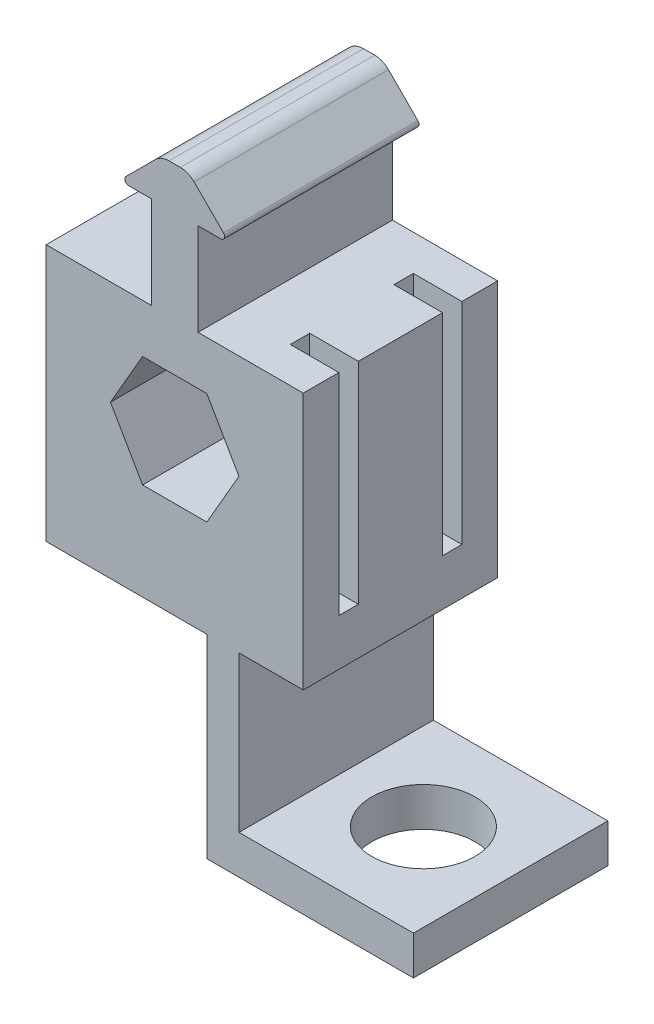
from build123d import *

# Parameters (mm, degrees)
BOSS_EXTRUDE1_DEPTH = 12.7
SKETCH8_W           = 2.54
SKETCH8_H           = 27.5
CUT_EXTRUDE1_DEPTH  = 6.35
SKETCH3_W           = 4.197769469
SKETCH3_H           = 25.4
BOSS_EXTRUDE2_DEPTH = 25.4
SKETCH4_W           = 22.800422122
SKETCH4_H           = 25.4
SKETCH4_R           = 6.75
BOSS_EXTRUDE3_DEPTH = 5.08


with BuildPart() as part:
    # Sketch1 → Boss-Extrude1 (new, symmetric)
    with BuildSketch(Plane.XY):
        with BuildLine():
            Line((-16.79575, 13.62075), (-16.79575, -19.97075))
            Line((-16.79575, -19.97075), (16.79575, -19.97075))
            Line((16.79575, -19.97075), (16.79575, 13.62075))
            Line((16.79575, 13.62075), (3.048, 13.62075))
            Line((3.048, 13.62075), (3.048, 25.68575))
            Line((3.048, 25.68575), (6.01257951, 25.68575))
            ThreePointArc((6.01257951, 25.68575), (6.481910313, 25.999346816), (6.371789755, 26.552960245))
            Line((6.371789755, 26.552960245), (2.532108776, 30.392641224))
            ThreePointArc((2.532108776, 30.392641224), (1.70807347, 30.943244013), (0.736057552, 31.13659))
            Line((0.736057552, 31.13659), (-0.736057552, 31.13659))
            ThreePointArc((-0.736057552, 31.13659), (-1.70807347, 30.943244013), (-2.532108776, 30.392641224))
            Line((-2.532108776, 30.392641224), (-6.371789755, 26.552960245))
            ThreePointArc((-6.371789755, 26.552960245), (-6.481910313, 25.999346816), (-6.01257951, 25.68575))
            Line((-6.01257951, 25.68575), (-3.048, 25.68575))
            Line((-3.048, 25.68575), (-3.048, 13.62075))
            Line((-3.048, 13.62075), (-16.79575, 13.62075))
        make_face()
        Polygon((-4.19776947, 7.27075), (-8.395538939, 0), (-4.19776947, -7.27075), (4.19776947, -7.27075), (8.395538939, 0), (4.19776947, 7.27075), align=None, mode=Mode.SUBTRACT)
    extrude(amount=BOSS_EXTRUDE1_DEPTH, both=True)

    # Sketch8 → Cut-Extrude1 (cut)
    with BuildSketch(Plane(origin=(16.79575, 0, 0), x_dir=(0, 0, -1), z_dir=(1, 0, 0))):
        with Locations((-6.77, -0.12925)):
            Rectangle(SKETCH8_W, SKETCH8_H)
        with Locations((6.77, -0.12925)):
            Rectangle(SKETCH8_W, SKETCH8_H)
    extrude(amount=-CUT_EXTRUDE1_DEPTH, mode=Mode.SUBTRACT)

    # Sketch3 → Boss-Extrude2 (add)
    with BuildSketch(Plane.XZ.offset(19.97075)):
        with Locations((6.296654204, 0)):
            Rectangle(SKETCH3_W, SKETCH3_H)
    extrude(amount=BOSS_EXTRUDE2_DEPTH)

    # Sketch4 → Boss-Extrude3 (add)
    with BuildSketch(Plane.XZ.offset(45.37075)):
        with Locations((19.79575, 0)):
            Rectangle(SKETCH4_W, SKETCH4_H)
        with Locations((19.79575, 0)):
            Circle(SKETCH4_R, mode=Mode.SUBTRACT)
    extrude(amount=-BOSS_EXTRUDE3_DEPTH)


solid = part.part
